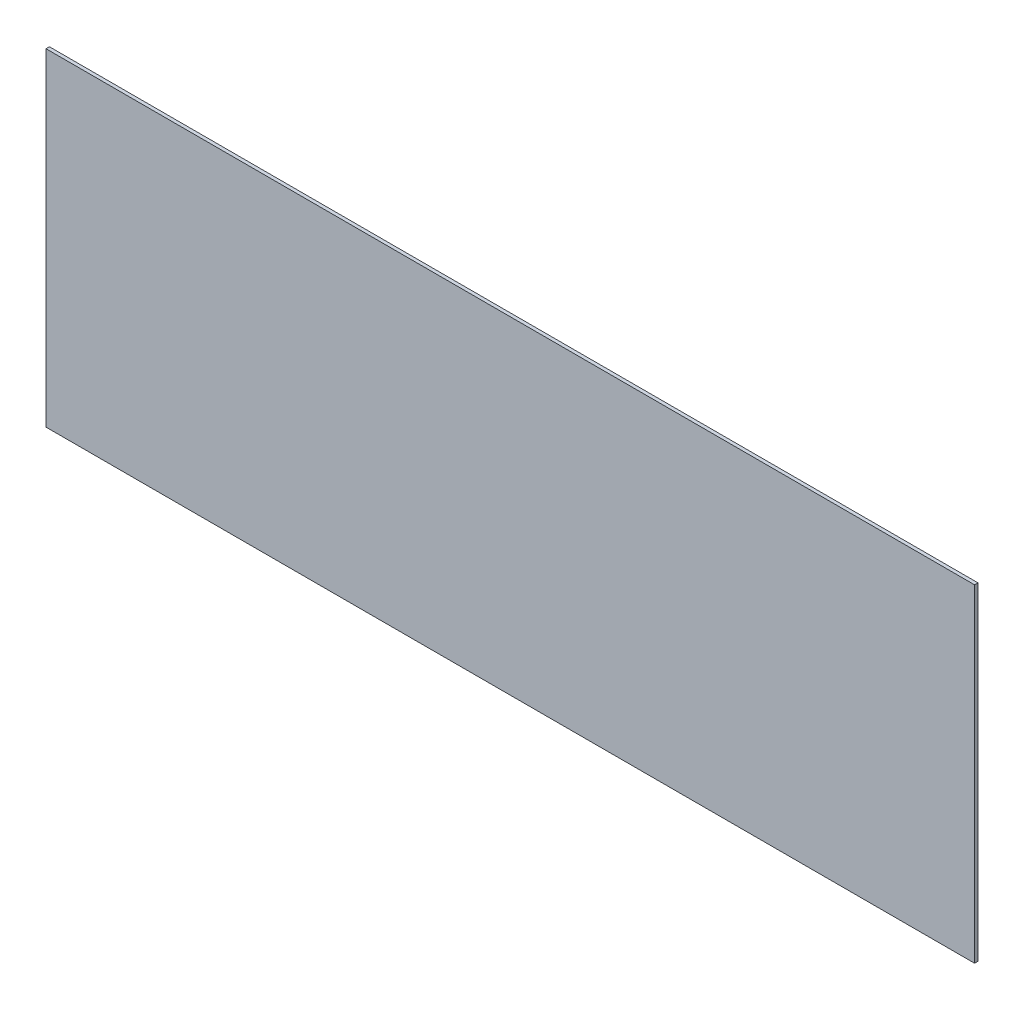
from build123d import *

# Parameters (mm, degrees)
SKETCH1_W           = 863.6
SKETCH1_H           = 304.8
BOSS_EXTRUDE1_DEPTH = 3.175


with BuildPart() as part:
    # Sketch1 → Boss-Extrude1 (new body)
    with BuildSketch(Plane.XY):
        with Locations((192.946174142, 118.622691293)):
            Rectangle(SKETCH1_W, SKETCH1_H)
    extrude(amount=BOSS_EXTRUDE1_DEPTH)


solid = part.part
